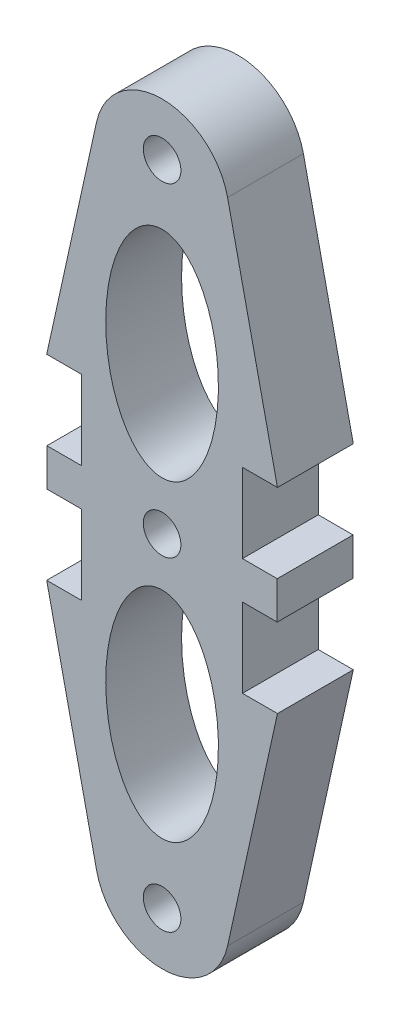
from build123d import *

# Parameters (mm, degrees)
SKETCH1_R           = 1.45
BOSS_EXTRUDE1_DEPTH = 5.85


with BuildPart() as part:
    # Sketch1 → Boss-Extrude1 (new body)
    with BuildSketch(Plane.XY):
        with BuildLine():
            Line((781.459168709, 470.952359197), (781.459168709, 464.852359197))
            Line((781.459168709, 464.852359197), (778.776092953, 464.852359197))
            Line((778.776092953, 464.852359197), (778.776092953, 461.952359197))
            Line((778.776092953, 461.952359197), (781.459168709, 461.952359197))
            Line((781.459168709, 461.952359197), (781.459168709, 455.852359197))
            Line((781.459168709, 455.852359197), (778.759168709, 455.852359197))
            Line((778.759168709, 455.852359197), (782.606547069, 438.402359197))
            ThreePointArc((782.606547069, 438.402359197), (787.659168709, 434.342389784), (792.711790348, 438.402359197))
            Line((792.711790348, 438.402359197), (796.559168709, 455.852359197))
            Line((796.559168709, 455.852359197), (793.859168709, 455.852359197))
            Line((793.859168709, 455.852359197), (793.859168709, 461.952359197))
            Line((793.859168709, 461.952359197), (796.542244464, 461.952359197))
            Line((796.542244464, 461.952359197), (796.542244464, 464.852359197))
            Line((796.542244464, 464.852359197), (793.859168709, 464.852359197))
            Line((793.859168709, 464.852359197), (793.859168709, 470.952359197))
            Line((793.859168709, 470.952359197), (796.559168709, 470.952359197))
            Line((796.559168709, 470.952359197), (792.711790348, 488.402359197))
            ThreePointArc((792.711790348, 488.402359197), (787.659168709, 492.46232861), (782.606547069, 488.402359197))
            Line((782.606547069, 488.402359197), (778.759168709, 470.952359197))
            Line((778.759168709, 470.952359197), (781.459168709, 470.952359197))
        make_face()
        with Locations((787.659168709, 438.402359197)):
            Circle(SKETCH1_R, mode=Mode.SUBTRACT)
        with BuildLine():
            add(Edge.make_bspline(
                [(787.659168709, 443.054519601), (795.187523069, 443.054519601), (791.423345889, 455.507640433), (787.659168709, 467.960761265), (783.894991529, 455.507640433), (780.130814348, 443.054519601), (787.659168709, 443.054519601)],
                knots=[0, 0, 0, 2.094395102, 2.094395102, 4.188790205, 4.188790205, 6.283185307, 6.283185307, 6.283185307], degree=2, weights=[1, 0.5, 1, 0.5, 1, 0.5, 1]))
        make_face(mode=Mode.SUBTRACT)
        with Locations((787.659168709, 463.402359197)):
            Circle(SKETCH1_R, mode=Mode.SUBTRACT)
        with BuildLine():
            add(Edge.make_bspline(
                [(787.659168709, 483.750198792), (780.130814348, 483.750198792), (783.894991529, 471.29707796), (787.659168709, 458.843957128), (791.423345889, 471.29707796), (795.187523069, 483.750198792), (787.659168709, 483.750198792)],
                knots=[0, 0, 0, 2.094395102, 2.094395102, 4.188790205, 4.188790205, 6.283185307, 6.283185307, 6.283185307], degree=2, weights=[1, 0.5, 1, 0.5, 1, 0.5, 1]))
        make_face(mode=Mode.SUBTRACT)
        with Locations((787.659168709, 488.402359197)):
            Circle(SKETCH1_R, mode=Mode.SUBTRACT)
    extrude(amount=BOSS_EXTRUDE1_DEPTH)


solid = part.part
